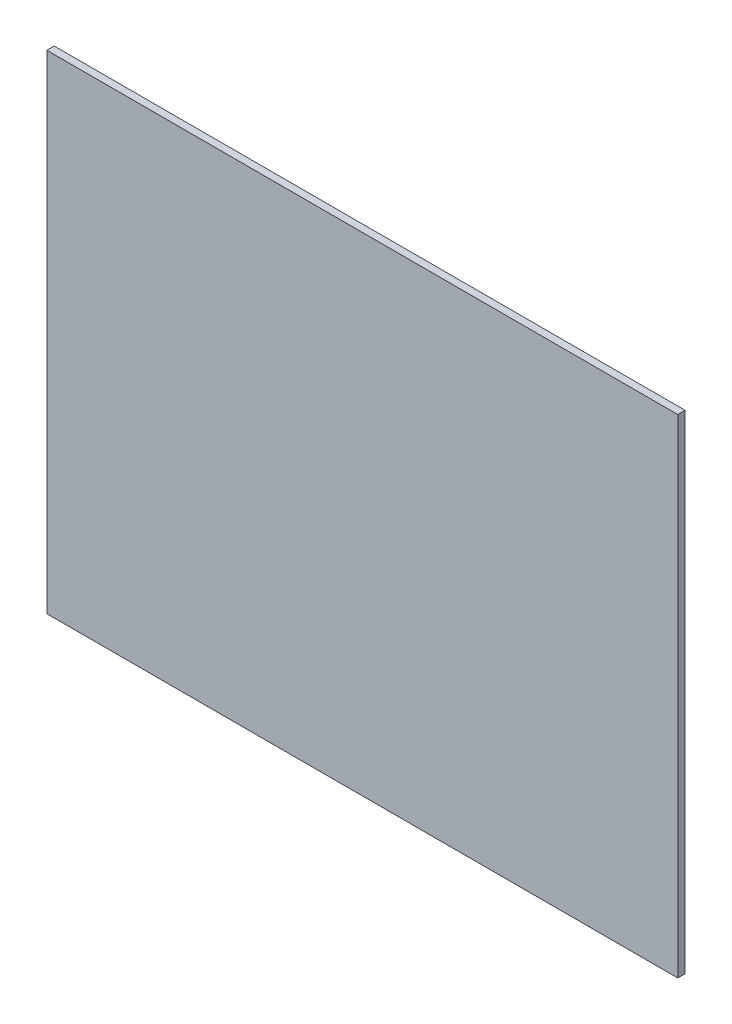
from build123d import *

# Parameters (mm, degrees)
EXTRUDE_START   = 1.3
SKETCH_1_W      = 42.8
SKETCH_1_H      = 33.1
EXTRUDE_1_DEPTH = 0.5


with BuildPart() as part:
    # Эскиз1 → Бобышка-Вытянуть1 (new body)
    with BuildSketch(Plane.XY.offset(EXTRUDE_START)):
        with Locations((-1.9, 0)):
            Rectangle(SKETCH_1_W, SKETCH_1_H)
    extrude(amount=EXTRUDE_1_DEPTH)


solid = part.part
